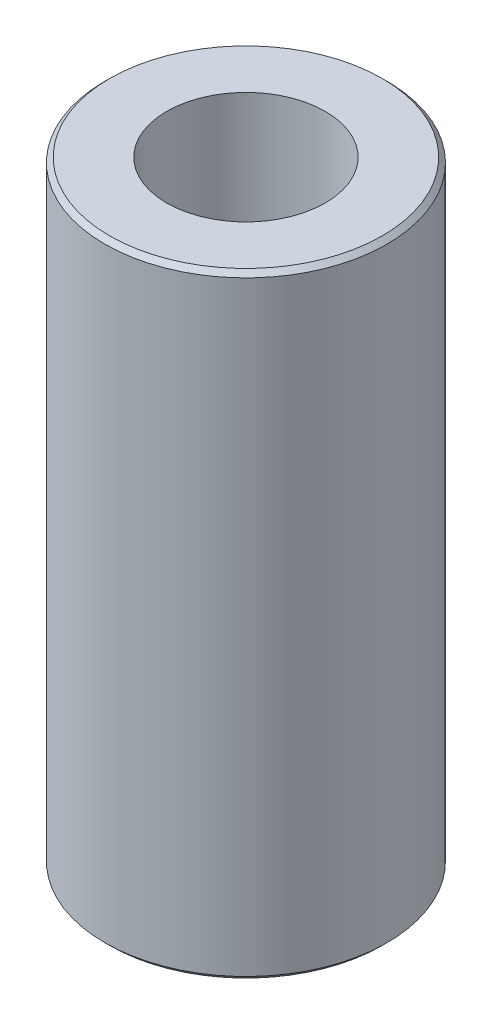
from build123d import *

# Parameters (mm, degrees)
SKETCH1_R           = 60
BOSS_EXTRUDE1_DEPTH = 261.346993345
SKETCH2_R           = 33.745556564
CUT_EXTRUDE1_DEPTH  = 275.776729237
CHAMFER1_SIZE       = 2.035783119


with BuildPart() as part:
    # Sketch1 → Boss-Extrude1 (new body)
    with BuildSketch(Plane(origin=(0, 0, 0), x_dir=(1, 0, 0), z_dir=(0, 1, 0))):
        Circle(SKETCH1_R)
    extrude(amount=BOSS_EXTRUDE1_DEPTH)

    # Sketch2 → Cut-Extrude1 (cut, through all)
    with BuildSketch(Plane(origin=(0, 0, 0), x_dir=(1, 0, 0), z_dir=(0, 1, 0))):
        Circle(SKETCH2_R)
    extrude(amount=CUT_EXTRUDE1_DEPTH, mode=Mode.SUBTRACT)

    # Chamfer1
    chamfer1_edges = [part.edges().sort_by_distance(p)[0] for p in [
        (-60, 261.346993345, 0),
        (-60, 0, 0),
    ]]
    chamfer(chamfer1_edges, length=CHAMFER1_SIZE)


solid = part.part
